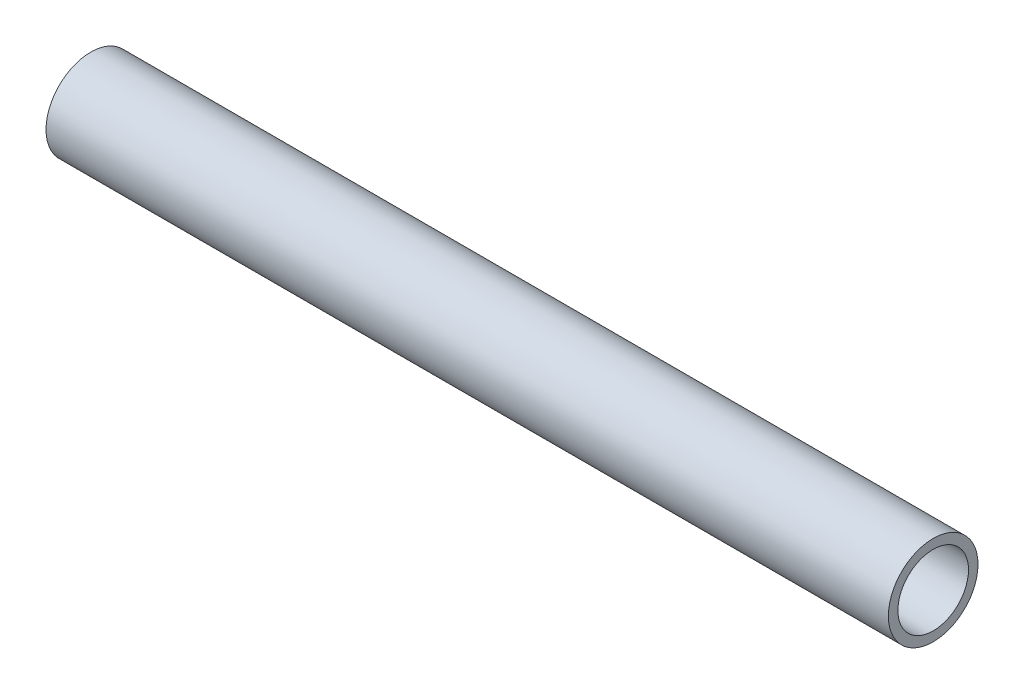
from build123d import *

# Parameters (mm, degrees)
SKETCH1_R           = 10.795
SKETCH1_R_2         = 8.509
BOSS_EXTRUDE1_DEPTH = 203.2
CHAMFER1_SIZE       = 2.54


with BuildPart() as part:
    # Sketch1 → Boss-Extrude1 (new body)
    with BuildSketch(Plane(origin=(0, 0, 0), x_dir=(0, 0, -1), z_dir=(1, 0, 0))):
        Circle(SKETCH1_R)
        Circle(SKETCH1_R_2, mode=Mode.SUBTRACT)
    extrude(amount=BOSS_EXTRUDE1_DEPTH)

    # Chamfer1
    # the kernel refuses this chamfer: 2.54 mm, written as the material it takes off along each edge
    with BuildSketch(Plane(origin=(0, 0, 0), x_dir=(0, 0, -1), z_dir=(0, -1, 0))) as chamfer1_piece_1:
        Polygon((8.509, CHAMFER1_SIZE), (8.509 + CHAMFER1_SIZE, 0), (8.509, 0), align=None)
    revolve(axis=Axis((0, 0, 0), (1, 0, 0)), mode=Mode.SUBTRACT)


solid = part.part
